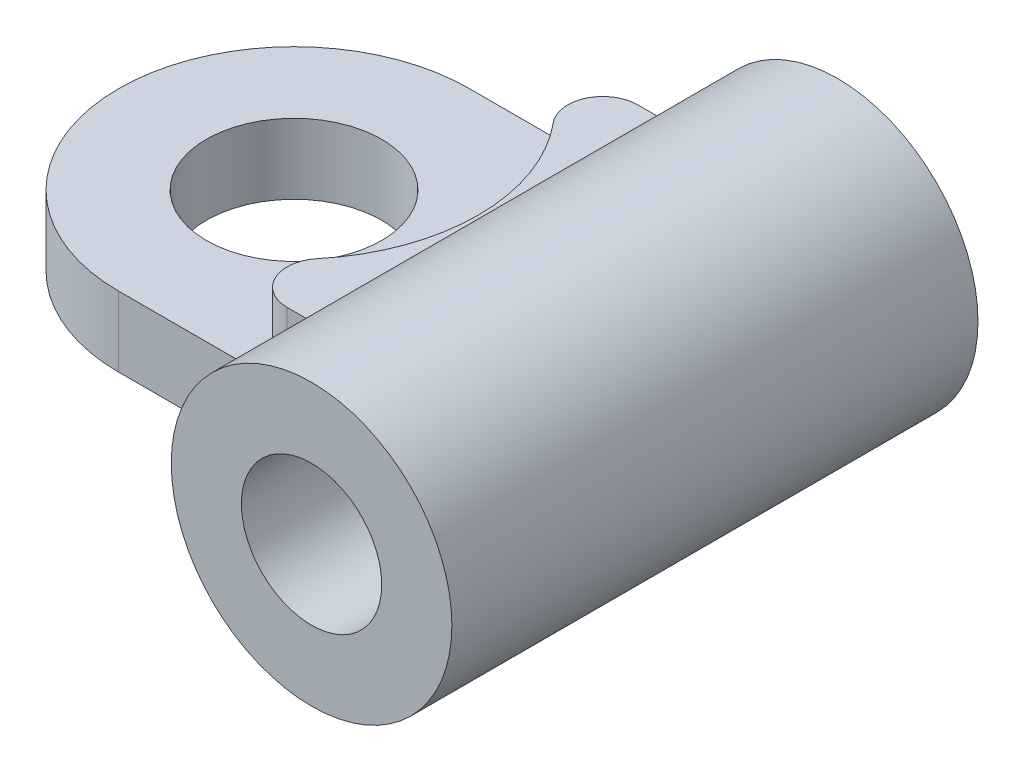
from build123d import *

# Parameters (mm, degrees)
SKETCH1_R           = 8
SKETCH1_R_2         = 4
BOSS_EXTRUDE1_DEPTH = 30
BOSS_EXTRUDE2_DEPTH = 4
SKETCH3_R           = 10.5
CUT_EXTRUDE1_DEPTH  = 4
FILLET1_R           = 2
SKETCH4_R           = 5
CUT_EXTRUDE2_DEPTH  = 4


with BuildPart() as part:
    # Sketch1 → Boss-Extrude1 (new body)
    with BuildSketch(Plane.XY):
        Circle(SKETCH1_R)
        Circle(SKETCH1_R_2, mode=Mode.SUBTRACT)
    extrude(amount=BOSS_EXTRUDE1_DEPTH)


with BuildPart() as body_2:
    # Sketch2 → Boss-Extrude2 (new, symmetric)
    with BuildSketch(Plane(origin=(0, 0, 0), x_dir=(1, 0, 0), z_dir=(0, 1, 0))):
        with BuildLine():
            Line((-5, -3), (-18, -3))
            ThreePointArc((-18, -3), (-28, -13), (-18, -23))
            Line((-18, -23), (-5, -23))
            Line((-5, -23), (-5, -3))
        make_face()
    extrude(amount=BOSS_EXTRUDE2_DEPTH, both=True)


with BuildPart() as cut_extrude1_tool:
    # Sketch3 → Cut-Extrude1 (new body)
    with BuildSketch(Plane(origin=(0, 4, 0), x_dir=(1, 0, 0), z_dir=(0, 1, 0))):
        with Locations((-18, -13)):
            Circle(SKETCH3_R)
    extrude(amount=-CUT_EXTRUDE1_DEPTH)


with BuildPart() as part_1:
    add(part.part)

    # Cut-Extrude1: cut by cut_extrude1_tool
    add(cut_extrude1_tool.part, mode=Mode.SUBTRACT)


with BuildPart() as body_2_1:
    add(body_2.part)

    # Cut-Extrude1: cut by cut_extrude1_tool
    add(cut_extrude1_tool.part, mode=Mode.SUBTRACT)

    # Fillet1
    fillet1_edges = [body_2_1.edges().sort_by_distance(p)[0] for p in [
        (-14.798437881, 2, 23),
        (-14.798437881, 2, 3),
    ]]
    fillet(fillet1_edges, radius=FILLET1_R)

    # Sketch4 → Cut-Extrude2 (cut)
    with BuildSketch(Plane(origin=(0, 0, 0), x_dir=(1, 0, 0), z_dir=(0, 1, 0))):
        with Locations((-18, -13)):
            Circle(SKETCH4_R)
    extrude(amount=-CUT_EXTRUDE2_DEPTH, mode=Mode.SUBTRACT)


solid = Compound([part_1.part, body_2_1.part])
